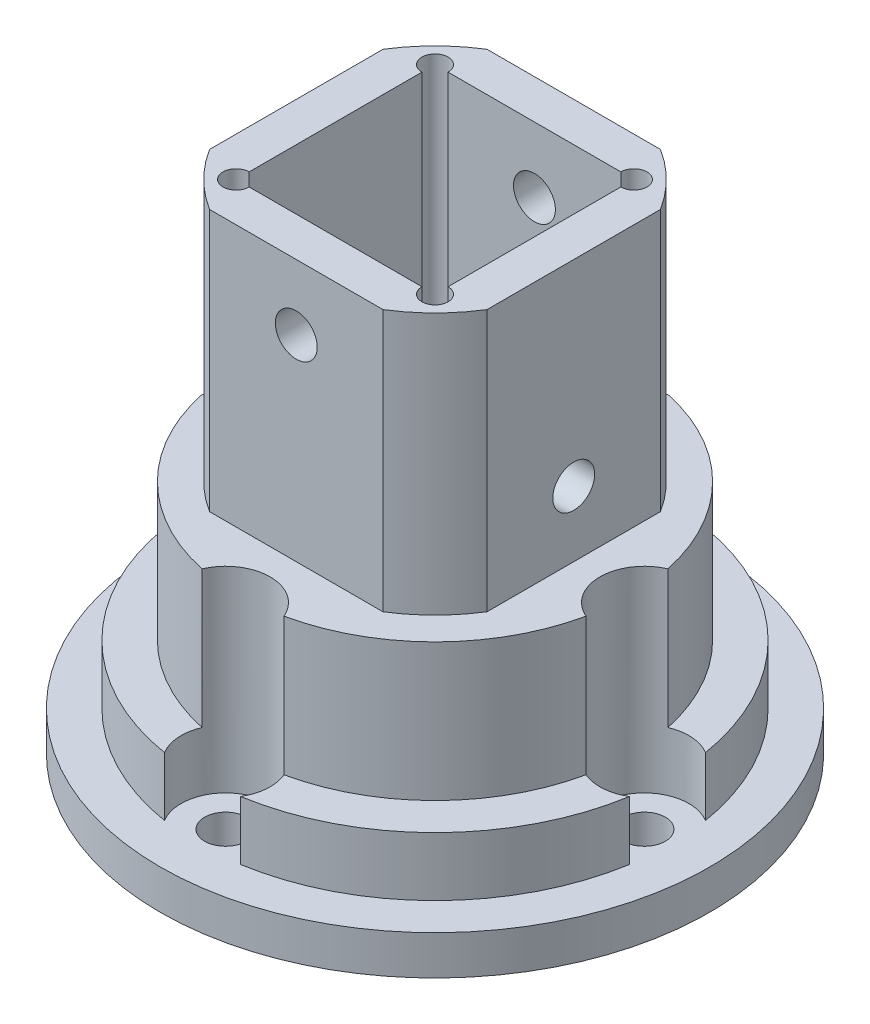
from build123d import *

# Parameters (mm, degrees)
SKETCH_1_R               = 12.5
EXTRUDE_1_DEPTH          = 7.5
EXTRUDE_2_DEPTH          = 10
EXTRUDE_START            = -4.5
SKETCH_3_R               = 18
SKETCH_3_R_2             = 12.5
EXTRUDE_3_DEPTH          = 4.5
SKETCH_4_R               = 2.1
CUT_EXTRUDE_1_DEPTH      = 39.055354
SKETCH_5_R               = 1.6
CUT_EXTRUDE_2_DEPTH      = 39.055354
CUT_EXTRUDE_START        = -10
CUT_EXTRUDE_3_DEPTH      = 10
SKETCH_7_R               = 21
EXTRUDE_4_DEPTH          = 3
SKETCH_8_R               = 1.6
CUT_EXTRUDE_4_DEPTH      = 41.816663
SKETCH_13_R              = 15
SKETCH_13_R_2            = 12.5
EXTRUDE_6_DEPTH          = 10.5
CUT_EXTRUDE_6_DEPTH      = 39.820098
CUT_EXTRUDE_6_DEPTH_BACK = 39.820098
CUT_EXTRUDE_START_2      = 10.5
SKETCH_9_R               = 3.4
CUT_EXTRUDE_5_DEPTH      = 15
EXTRUDE_5_DEPTH          = 10
SKETCH_12_R              = 1.6
CUT_EXTRUDE_7_DEPTH      = 47.859471


# Read off the part's stored shape, not the designer's step: 凸台-拉伸2
with BuildPart() as part:
    # 草图1 → 凸台-拉伸1 (new, symmetric)
    with BuildSketch(Plane(origin=(0, 0, 0), x_dir=(1, 0, 0), z_dir=(0, 1, 0))):
        with Locations(Location((0, 0, 0), (0, 0, 270))):
            Circle(SKETCH_1_R)
        with BuildLine():
            Line((6.6, -7.6), (-6.6, -7.6))
            ThreePointArc((-6.6, -7.6), (-8.307107, -8.307107), (-7.6, -6.6))
            Line((-7.6, -6.6), (-7.6, 6.6))
            ThreePointArc((-7.6, 6.6), (-8.307107, 8.307107), (-6.6, 7.6))
            Line((-6.6, 7.6), (6.6, 7.6))
            ThreePointArc((6.6, 7.6), (7.6, 8.6), (8.6, 7.6))
            ThreePointArc((8.6, 7.6), (8.307107, 6.892893), (7.6, 6.6))
            Line((7.6, 6.6), (7.6, -6.6))
            ThreePointArc((7.6, -6.6), (8.307107, -6.892893), (8.6, -7.6))
            ThreePointArc((8.6, -7.6), (7.6, -8.6), (6.6, -7.6))
        make_face(mode=Mode.SUBTRACT)
    extrude(amount=EXTRUDE_1_DEPTH, both=True)

    # 凸台-拉伸2 outline → 凸台-拉伸2 (add)
    with BuildSketch(Plane.XZ.offset(7.5)):
        with BuildLine():
            Line((10.6, -6.624953), (10.6, 6.624953))
            ThreePointArc((10.6, 6.624953), (8.838835, 8.838835), (6.624953, 10.6))
            Line((6.624953, 10.6), (-6.624953, 10.6))
            ThreePointArc((-6.624953, 10.6), (-8.838835, 8.838835), (-10.6, 6.624953))
            Line((-10.6, 6.624953), (-10.6, -6.624953))
            ThreePointArc((-10.6, -6.624953), (-8.838835, -8.838835), (-6.624953, -10.6))
            Line((-6.624953, -10.6), (6.624953, -10.6))
            ThreePointArc((6.624953, -10.6), (8.838835, -8.838835), (10.6, -6.624953))
        make_face()
        with BuildLine():
            ThreePointArc((-6.6, -7.6), (-8.307107, -8.307107), (-7.6, -6.6))
            Line((-7.6, -6.6), (-7.6, 6.6))
            ThreePointArc((-7.6, 6.6), (-8.307107, 8.307107), (-6.6, 7.6))
            Line((-6.6, 7.6), (6.6, 7.6))
            ThreePointArc((6.6, 7.6), (8.307107, 8.307107), (7.6, 6.6))
            Line((7.6, 6.6), (7.6, -6.6))
            ThreePointArc((7.6, -6.6), (8.307107, -8.307107), (6.6, -7.6))
            Line((6.6, -7.6), (-6.6, -7.6))
        make_face(mode=Mode.SUBTRACT)
    extrude_2 = extrude(amount=EXTRUDE_2_DEPTH)

    # 镜向1: 凸台-拉伸2 across plane
    add(extrude_2.mirror(Plane.ZX))

    # 草图3 → 凸台-拉伸3 (add)
    with BuildSketch(Plane.XZ.offset(7.5).offset(EXTRUDE_START)):
        with Locations(Location((0, 0, 0), (0, 0, 270))):
            Circle(SKETCH_3_R)
        with Locations(Location((0, 0, 0), (0, 0, 270))):
            Circle(SKETCH_3_R_2, mode=Mode.SUBTRACT)
    extrude(amount=EXTRUDE_3_DEPTH)

    # 草图4 → 切除-拉伸1 (cut, through all)
    with BuildSketch(Plane.XY.offset(10.6)):
        with Locations((0, -12.5)):
            Circle(SKETCH_4_R)
    extrude(amount=-CUT_EXTRUDE_1_DEPTH, mode=Mode.SUBTRACT)

    # 草图5 → 切除-拉伸2 (cut, through all)
    with BuildSketch(Plane(origin=(10.6, 0, 0), x_dir=(0, 0, -1), z_dir=(1, 0, 0))):
        with Locations((0, 12.5)):
            Circle(SKETCH_5_R)
    extrude(amount=-CUT_EXTRUDE_2_DEPTH, mode=Mode.SUBTRACT)

    # 草图6 → 切除-拉伸3 (cut)
    with BuildSketch(Plane.XZ.offset(17.5).offset(CUT_EXTRUDE_START)):
        with BuildLine():
            Line((10.6, -6.624953), (10.6, 6.624953))
            ThreePointArc((10.6, 6.624953), (8.838835, 8.838835), (6.624953, 10.6))
            Line((6.624953, 10.6), (-6.624953, 10.6))
            ThreePointArc((-6.624953, 10.6), (-8.838835, 8.838835), (-10.6, 6.624953))
            Line((-10.6, 6.624953), (-10.6, -6.624953))
            ThreePointArc((-10.6, -6.624953), (-8.838835, -8.838835), (-6.624953, -10.6))
            Line((-6.624953, -10.6), (6.624953, -10.6))
            ThreePointArc((6.624953, -10.6), (8.838835, -8.838835), (10.6, -6.624953))
        make_face()
    extrude(amount=CUT_EXTRUDE_3_DEPTH, mode=Mode.SUBTRACT)

    # 草图7 → 凸台-拉伸4 (add)
    with BuildSketch(Plane.XZ.offset(7.5)):
        with Locations(Location((0, 0, 0), (0, 0, 270))):
            Circle(SKETCH_7_R)
    extrude(amount=EXTRUDE_4_DEPTH)

    # 草图8 → 切除-拉伸4 (cut, through all)
    with BuildSketch(Plane.XZ.offset(10.5)):
        with Locations(Location((0, 16, 0), (0, 0, 270))):
            Circle(SKETCH_8_R)
        with Locations(Location((16, 0, 0), (0, 0, 270))):
            Circle(SKETCH_8_R)
        with Locations(Location((0, -16, 0), (0, 0, 270))):
            Circle(SKETCH_8_R)
        with Locations(Location((-16, 0, 0), (0, 0, 270))):
            Circle(SKETCH_8_R)
    extrude(amount=-CUT_EXTRUDE_4_DEPTH, mode=Mode.SUBTRACT)

    # 草图13 → 凸台-拉伸6 (add)
    with BuildSketch(Plane(origin=(0, -3, 0), x_dir=(1, 0, 0), z_dir=(0, 1, 0))):
        with Locations(Location((0, 0, 0), (0, 0, 85.379415))):
            Circle(SKETCH_13_R)
        Circle(SKETCH_13_R_2, mode=Mode.SUBTRACT)
    extrude(amount=EXTRUDE_6_DEPTH)

    # 草图10 → 切除-拉伸6 (cut, two sides: drawn at the far end of the back side and taken through both)
    with BuildSketch(Plane(origin=(0, -7.5, 0), x_dir=(1, 0, 0), z_dir=(0, 1, 0)).offset(-CUT_EXTRUDE_6_DEPTH_BACK)):
        with BuildLine():
            Line((-7.6, 6.6), (-7.6, -6.6))
            ThreePointArc((-7.6, -6.6), (-8.307107, -8.307107), (-6.6, -7.6))
            Line((-6.6, -7.6), (6.6, -7.6))
            ThreePointArc((6.6, -7.6), (8.307107, -8.307107), (7.6, -6.6))
            Line((7.6, -6.6), (7.6, 6.6))
            ThreePointArc((7.6, 6.6), (8.307107, 8.307107), (6.6, 7.6))
            Line((6.6, 7.6), (-6.6, 7.6))
            ThreePointArc((-6.6, 7.6), (-8.307107, 8.307107), (-7.6, 6.6))
        make_face()
    extrude(amount=CUT_EXTRUDE_6_DEPTH + CUT_EXTRUDE_6_DEPTH_BACK, mode=Mode.SUBTRACT)

    # 草图9 → 切除-拉伸5 (cut)
    with BuildSketch(Plane(origin=(0, -3, 0), x_dir=(1, 0, 0), z_dir=(0, 1, 0)).offset(CUT_EXTRUDE_START_2)):
        with Locations((0, -16)):
            Circle(SKETCH_9_R)
        with Locations((16, 0)):
            Circle(SKETCH_9_R)
        with Locations((0, 16)):
            Circle(SKETCH_9_R)
        with Locations((-16, 0)):
            Circle(SKETCH_9_R)
    extrude(amount=-CUT_EXTRUDE_5_DEPTH, mode=Mode.SUBTRACT)

    # 草图11 → 凸台-拉伸5 (add)
    with BuildSketch(Plane(origin=(0, 17.5, 0), x_dir=(1, 0, 0), z_dir=(0, 1, 0))):
        with BuildLine():
            Line((6.624953, 10.6), (-6.624953, 10.6))
            ThreePointArc((-6.624953, 10.6), (-8.838835, 8.838835), (-10.6, 6.624953))
            Line((-10.6, 6.624953), (-10.6, -6.624953))
            ThreePointArc((-10.6, -6.624953), (-8.838835, -8.838835), (-6.624953, -10.6))
            Line((-6.624953, -10.6), (6.624953, -10.6))
            ThreePointArc((6.624953, -10.6), (8.838835, -8.838835), (10.6, -6.624953))
            Line((10.6, -6.624953), (10.6, 6.624953))
            ThreePointArc((10.6, 6.624953), (8.838835, 8.838835), (6.624953, 10.6))
        make_face()
        with BuildLine():
            Line((-6.6, -7.6), (6.6, -7.6))
            ThreePointArc((6.6, -7.6), (8.307107, -8.307107), (7.6, -6.6))
            Line((7.6, -6.6), (7.6, 6.6))
            ThreePointArc((7.6, 6.6), (8.307107, 8.307107), (6.6, 7.6))
            Line((6.6, 7.6), (-6.6, 7.6))
            ThreePointArc((-6.6, 7.6), (-8.307107, 8.307107), (-7.6, 6.6))
            Line((-7.6, 6.6), (-7.6, -6.6))
            ThreePointArc((-7.6, -6.6), (-8.307107, -8.307107), (-6.6, -7.6))
        make_face(mode=Mode.SUBTRACT)
    extrude(amount=EXTRUDE_5_DEPTH)

    # 草图12 → 切除-拉伸7 (cut, through all)
    with BuildSketch(Plane(origin=(0, 0, -10.6), x_dir=(-1, 0, 0), z_dir=(0, 0, -1))):
        with Locations((0, 22.5)):
            Circle(SKETCH_12_R)
    extrude(amount=-CUT_EXTRUDE_7_DEPTH, mode=Mode.SUBTRACT)


solid = part.part
